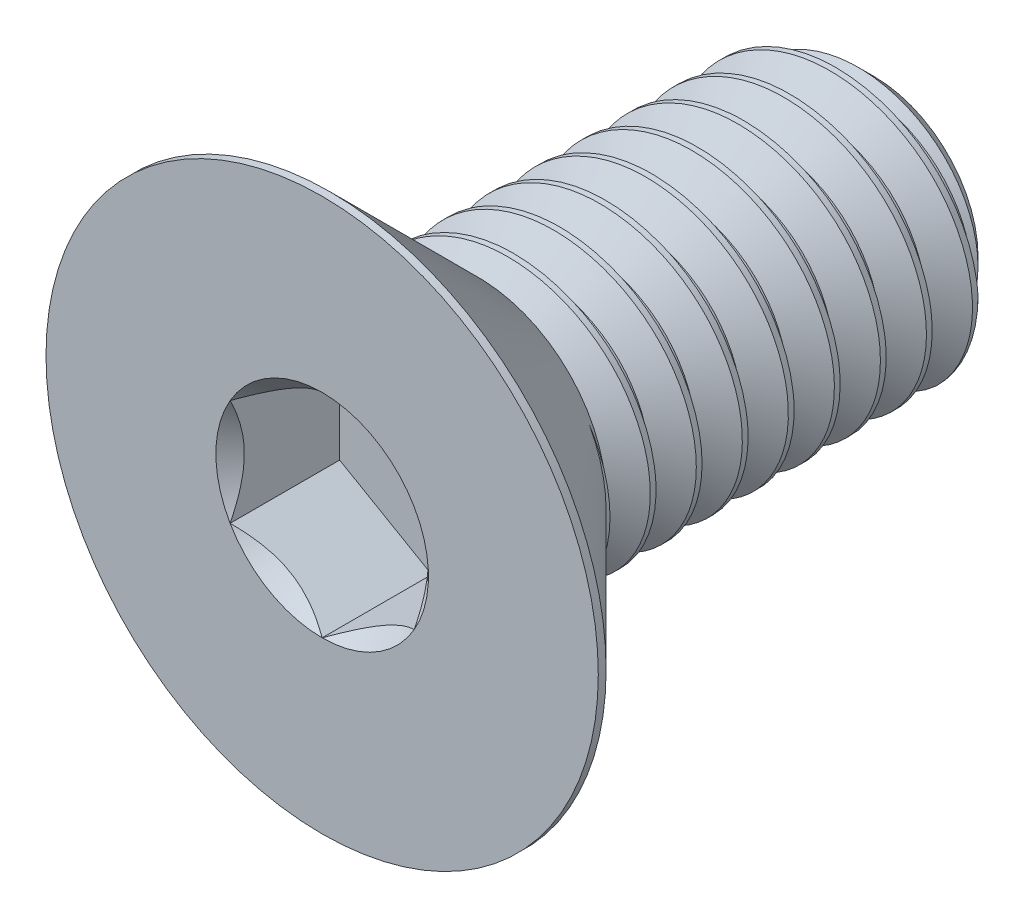
from build123d import *

# Parameters (mm, degrees)
CHAMFER1_SIZE      = 0.375
CUT_EXTRUDE2_DEPTH = 1.19
CUT_SWEEP1_PITCH   = 0.5


with BuildPart() as part:
    # Sketch1 → Revolve1 (revolve)
    with BuildSketch(Plane(origin=(0, 0, 0), x_dir=(0, 0, -1), z_dir=(1, 0, 0)), mode=Mode.PRIVATE) as revolve1_sk:
        Polygon((-1.3, 1.5), (3, 1.5), (3, 0), (-1.81, 0), (-1.81, 1.5), align=None)
    revolve(revolve1_sk.sketch.rotate(Axis((0, 0, 1.81), (0, 0, -1)), 180), axis=Axis((0, 0, 1.81), (0, 0, -1)))

    # Chamfer1
    chamfer1_edges = [part.edges().sort_by_distance(p)[0] for p in [
        (0, 1.5, -3),
    ]]
    chamfer(chamfer1_edges, length=CHAMFER1_SIZE)

    # Cut-Sweep1: the profile of Sketch13 screwed along a right-hand helix of 12 turns, 6 arcs to a turn; built about Z, then put on its axis
    cut_sweep1_z = Axis((0, 0, 0), (0, 0, 1))
    cut_sweep1_corners = [(1.527063294, 0, 0.015625), (1.527063294, 0, -0.453125), (1.175240474, 0, -0.25), (1.175240474, 0, -0.1875)]
    with BuildLine(mode=Mode.PRIVATE) as cut_sweep1_profile:
        Line(cut_sweep1_corners[0], cut_sweep1_corners[1])
        Line(cut_sweep1_corners[1], cut_sweep1_corners[2])
        Line(cut_sweep1_corners[2], cut_sweep1_corners[3])
        Line(cut_sweep1_corners[3], cut_sweep1_corners[0])
    cut_sweep1_cap = Face(cut_sweep1_profile.wire())
    cut_sweep1_turn_angles = [0, 30, 60, 90, 120, 150, 180, 210, 240, 270, 300, 330, 360]
    cut_sweep1_turn_weights = [1, 0.8660254037844387, 1, 0.8660254037844387, 1, 0.8660254037844387, 1, 0.8660254037844387, 1, 0.8660254037844387, 1, 0.8660254037844387, 1]
    cut_sweep1_turn_rails = [Edge.make_bspline([Vector(p[0], p[1], 0).rotate(cut_sweep1_z, cut_sweep1_turn_angles[k]) / cut_sweep1_turn_weights[k] + Vector(0, 0, p[2] + CUT_SWEEP1_PITCH * cut_sweep1_turn_angles[k] / 360) for k in range(13)], [0, 0, 0, 1, 1, 2, 2, 3, 3, 4, 4, 5, 5, 6, 6, 6], 2, cut_sweep1_turn_weights) for p in cut_sweep1_corners]
    cut_sweep1_turn_sides = [Face.make_surface_from_curves(cut_sweep1_turn_rails[p[0]], cut_sweep1_turn_rails[p[1]]) for p in [(0, 1), (1, 2), (2, 3), (3, 0)]]
    cut_sweep1 = Plane(origin=(0, 0, -3), x_dir=(0, 1, 0), z_dir=(0, 0, 1)) * Solid(Shell([*[p.moved(Location((0, 0, CUT_SWEEP1_PITCH * i))) for i in range(12) for p in cut_sweep1_turn_sides], cut_sweep1_cap, cut_sweep1_cap.rotate(cut_sweep1_z, 4320).moved(Location((0, 0, CUT_SWEEP1_PITCH * 4320 / 360)))]))
    add(cut_sweep1, mode=Mode.SUBTRACT)


with BuildPart() as body_2:
    # Sketch7 → Revolve2 (revolve)
    with BuildSketch(Plane(origin=(0, 0, 0), x_dir=(0, 0, -1), z_dir=(1, 0, 0)), mode=Mode.PRIVATE) as revolve2_sk:
        Polygon((-3, 3), (-2.915, 3), (-1.3, 1.385), (-1.3, 0), (-3, 0), align=None)
    revolve(revolve2_sk.sketch.rotate(Axis((0, 0, 3), (0, 0, -1)), 180), axis=Axis((0, 0, 3), (0, 0, -1)))

    # Sketch5 → Cut-Extrude2 (cut)
    with BuildSketch(Plane.XY.offset(3)):
        Polygon((1, -0.577350269), (1, 0.577350269), (0, 1.154700538), (-1, 0.577350269), (-1, -0.577350269), (0, -1.154700538), align=None)
    extrude(amount=-CUT_EXTRUDE2_DEPTH, mode=Mode.SUBTRACT)

    # Cut-Extrude3 cone 1 section (through the dimple's axis) → Cut-Extrude3 (revolve, cut)
    with BuildSketch(Plane(origin=(0, 0, 3), x_dir=(0, -1, 0), z_dir=(1, 0, 0))):
        Polygon((0, 0), (1.154700538, 0), (0, 1.154700538), align=None)
    revolve(axis=Axis((0, 0, 3), (0, 0, -1)), mode=Mode.SUBTRACT)

    # Combine1: union part
    add(part.part)


solid = body_2.part
